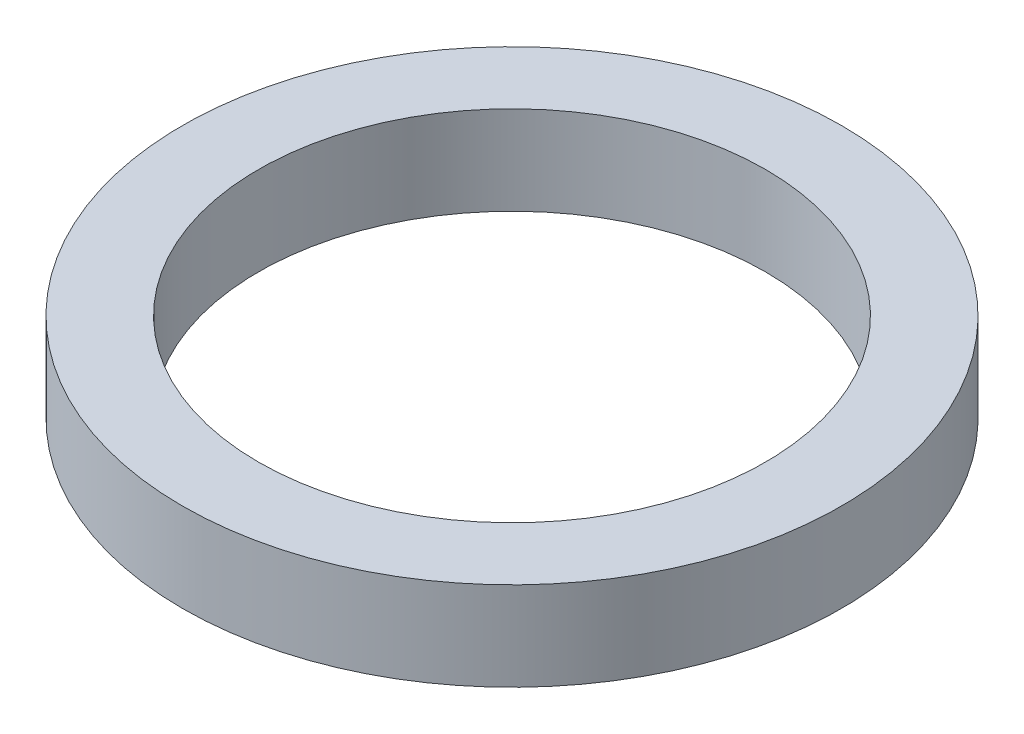
from build123d import *

# Parameters (mm, degrees)
SKETCH5_R           = 26
SKETCH5_R_2         = 20
BOSS_EXTRUDE5_DEPTH = 7


with BuildPart() as part:
    # Sketch5 → Boss-Extrude5 (new body)
    with BuildSketch(Plane(origin=(0, 0, 0), x_dir=(1, 0, 0), z_dir=(0, 1, 0))):
        Circle(SKETCH5_R)
        Circle(SKETCH5_R_2, mode=Mode.SUBTRACT)
    extrude(amount=BOSS_EXTRUDE5_DEPTH)


solid = part.part
